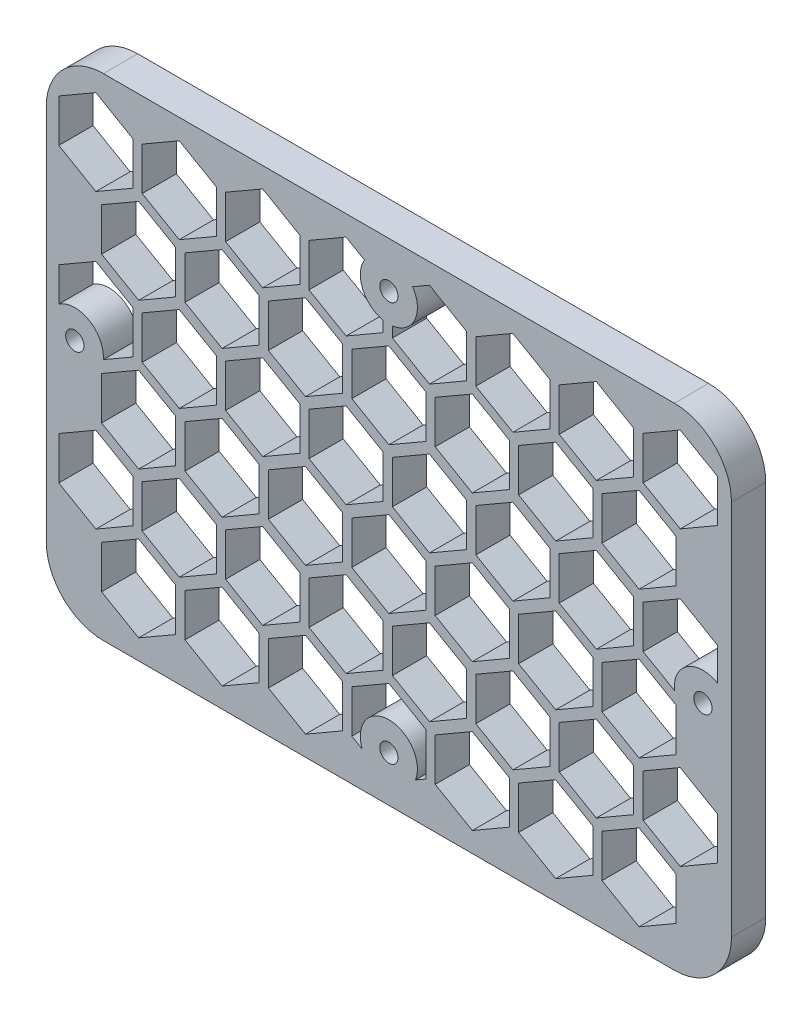
from build123d import *

# Parameters (mm, degrees)
PLAQUE_OUTLINE_R   = 1.6
PLAQUE_DEPTH       = 6
CUT_EXTRUDE2_DEPTH = 10


# Read off the part's stored shape, not the designer's step: plaque
with BuildPart() as part:
    # plaque outline → plaque (new body)
    with BuildSketch(Plane.XY):
        with BuildLine():
            Line((50, 43), (-50, 43))
            ThreePointArc((-50, 43), (-57.071067812, 40.071067812), (-60, 33))
            Line((-60, 33), (-60, -33))
            ThreePointArc((-60, -33), (-57.071067812, -40.071067812), (-50, -43))
            Line((-50, -43), (50, -43))
            ThreePointArc((50, -43), (57.071067812, -40.071067812), (60, -33))
            Line((60, -33), (60, 33))
            ThreePointArc((60, 33), (57.071067812, 40.071067812), (50, 43))
        make_face()
        with Locations((0, -35)):
            Circle(PLAQUE_OUTLINE_R, mode=Mode.SUBTRACT)
        with Locations((-55, 0)):
            Circle(PLAQUE_OUTLINE_R, mode=Mode.SUBTRACT)
        with Locations((55, 0)):
            Circle(PLAQUE_OUTLINE_R, mode=Mode.SUBTRACT)
        with Locations((0, 35)):
            Circle(PLAQUE_OUTLINE_R, mode=Mode.SUBTRACT)
    extrude(amount=PLAQUE_DEPTH)

    # Sketch2 → Cut-Extrude2 (cut)
    with BuildSketch(Plane(origin=(0, 0, 0), x_dir=(-1, 0, 0), z_dir=(0, 0, -1))):
        Polygon((-37.324809472, -35.75), (-37.324809472, -28.25), (-43.82, -24.5), (-50.315190528, -28.25), (-50.315190528, -35.75), (-43.82, -39.5), align=None)
        Polygon((-29.829618943, -23), (-29.829618943, -15.5), (-36.324809472, -11.75), (-42.82, -15.5), (-42.82, -23), (-36.324809472, -26.75), align=None)
        Polygon((-22.718142805, -35.75), (-22.718142805, -28.25), (-29.213333333, -24.5), (-35.708523862, -28.25), (-35.708523862, -35.75), (-29.213333333, -39.5), align=None)
        Polygon((-15.222952277, -23), (-15.222952277, -15.5), (-21.718142805, -11.75), (-28.213333333, -15.5), (-28.213333333, -23), (-21.718142805, -26.75), align=None)
        Polygon((-8.111476138, -35.75), (-8.111476138, -28.25), (-14.606666667, -24.5), (-21.101857195, -28.25), (-21.101857195, -35.75), (-14.606666667, -39.5), align=None)
        Polygon((-0.61628561, -23), (-0.61628561, -15.5), (-7.111476138, -11.75), (-13.606666667, -15.5), (-13.606666667, -23), (-7.111476138, -26.75), align=None)
        with BuildLine():
            Line((6.495190528, -35.75), (6.495190528, -28.25))
            Line((6.495190528, -28.25), (0, -24.5))
            Line((0, -24.5), (-6.495190528, -28.25))
            Line((-6.495190528, -28.25), (-6.495190528, -35.75))
            Line((-6.495190528, -35.75), (-4.66137396, -36.808754489))
            ThreePointArc((-4.66137396, -36.808754489), (0, -30), (4.66137396, -36.808754489))
            Line((4.66137396, -36.808754489), (6.495190528, -35.75))
        make_face()
        Polygon((13.990381057, -23), (13.990381057, -15.5), (7.495190528, -11.75), (1, -15.5), (1, -23), (7.495190528, -26.75), align=None)
        Polygon((21.101857195, -35.75), (21.101857195, -28.25), (14.606666667, -24.5), (8.111476138, -28.25), (8.111476138, -35.75), (14.606666667, -39.5), align=None)
        Polygon((28.597047723, -23), (28.597047723, -15.5), (22.101857195, -11.75), (15.606666667, -15.5), (15.606666667, -23), (22.101857195, -26.75), align=None)
        Polygon((35.708523862, -35.75), (35.708523862, -28.25), (29.213333333, -24.5), (22.718142805, -28.25), (22.718142805, -35.75), (29.213333333, -39.5), align=None)
        Polygon((43.20371439, -23), (43.20371439, -15.5), (36.708523862, -11.75), (30.213333333, -15.5), (30.213333333, -23), (36.708523862, -26.75), align=None)
        Polygon((50.315190528, -35.75), (50.315190528, -28.25), (43.82, -24.5), (37.324809472, -28.25), (37.324809472, -35.75), (43.82, -39.5), align=None)
        Polygon((57.810381057, -23), (57.810381057, -15.5), (51.315190528, -11.75), (44.82, -15.5), (44.82, -23), (51.315190528, -26.75), align=None)
        Polygon((-22.718142805, -10.15), (-22.718142805, -2.65), (-29.213333333, 1.1), (-35.708523862, -2.65), (-35.708523862, -10.15), (-29.213333333, -13.9), align=None)
        Polygon((-15.222952277, 2.6), (-15.222952277, 10.1), (-21.718142805, 13.85), (-28.213333333, 10.1), (-28.213333333, 2.6), (-21.718142805, -1.15), align=None)
        Polygon((-8.111476138, -10.15), (-8.111476138, -2.65), (-14.606666667, 1.1), (-21.101857195, -2.65), (-21.101857195, -10.15), (-14.606666667, -13.9), align=None)
        Polygon((-0.61628561, 2.6), (-0.61628561, 10.1), (-7.111476138, 13.85), (-13.606666667, 10.1), (-13.606666667, 2.6), (-7.111476138, -1.15), align=None)
        Polygon((6.495190528, -10.15), (6.495190528, -2.65), (0, 1.1), (-6.495190528, -2.65), (-6.495190528, -10.15), (0, -13.9), align=None)
        Polygon((13.990381057, 2.6), (13.990381057, 10.1), (7.495190528, 13.85), (1, 10.1), (1, 2.6), (7.495190528, -1.15), align=None)
        Polygon((21.101857195, -10.15), (21.101857195, -2.65), (14.606666667, 1.1), (8.111476138, -2.65), (8.111476138, -10.15), (14.606666667, -13.9), align=None)
        Polygon((28.597047723, 2.6), (28.597047723, 10.1), (22.101857195, 13.85), (15.606666667, 10.1), (15.606666667, 2.6), (22.101857195, -1.15), align=None)
        Polygon((35.708523862, -10.15), (35.708523862, -2.65), (29.213333333, 1.1), (22.718142805, -2.65), (22.718142805, -10.15), (29.213333333, -13.9), align=None)
        Polygon((43.20371439, 2.6), (43.20371439, 10.1), (36.708523862, 13.85), (30.213333333, 10.1), (30.213333333, 2.6), (36.708523862, -1.15), align=None)
        Polygon((50.315190528, -10.15), (50.315190528, -2.65), (43.82, 1.1), (37.324809472, -2.65), (37.324809472, -10.15), (43.82, -13.9), align=None)
        with BuildLine():
            Line((57.810381057, 4.135427223), (57.810381057, 10.1))
            Line((57.810381057, 10.1), (51.315190528, 13.85))
            Line((51.315190528, 13.85), (44.82, 10.1))
            Line((44.82, 10.1), (44.82, 2.6))
            Line((44.82, 2.6), (50.016019525, -0.399923271))
            ThreePointArc((50.016019525, -0.399923271), (52.485346021, 4.321633414), (57.810381057, 4.135427223))
        make_face()
        Polygon((-22.718142805, 15.45), (-22.718142805, 22.95), (-29.213333333, 26.7), (-35.708523862, 22.95), (-35.708523862, 15.45), (-29.213333333, 11.7), align=None)
        Polygon((-15.222952277, 28.2), (-15.222952277, 35.7), (-21.718142805, 39.45), (-28.213333333, 35.7), (-28.213333333, 28.2), (-21.718142805, 24.45), align=None)
        Polygon((-8.111476138, 15.45), (-8.111476138, 22.95), (-14.606666667, 26.7), (-21.101857195, 22.95), (-21.101857195, 15.45), (-14.606666667, 11.7), align=None)
        with BuildLine():
            ThreePointArc((-0.61628561, 30.038126156), (-4.540676264, 32.906615404), (-4.173388159, 37.753694114))
            Line((-4.173388159, 37.753694114), (-7.111476138, 39.45))
            Line((-7.111476138, 39.45), (-13.606666667, 35.7))
            Line((-13.606666667, 35.7), (-13.606666667, 28.2))
            Line((-13.606666667, 28.2), (-7.111476138, 24.45))
            Line((-7.111476138, 24.45), (-0.61628561, 28.2))
            Line((-0.61628561, 28.2), (-0.61628561, 30.038126156))
        make_face()
        with BuildLine():
            Line((7.495190528, 39.45), (4.276040949, 37.591423124))
            ThreePointArc((4.276040949, 37.591423124), (4.581013516, 32.996424405), (1, 30.101020514))
            Line((1, 30.101020514), (1, 28.2))
            Line((1, 28.2), (7.495190528, 24.45))
            Line((7.495190528, 24.45), (13.990381057, 28.2))
            Line((13.990381057, 28.2), (13.990381057, 35.7))
            Line((13.990381057, 35.7), (7.495190528, 39.45))
        make_face()
        Polygon((6.495190528, 15.45), (6.495190528, 22.95), (0, 26.7), (-6.495190528, 22.95), (-6.495190528, 15.45), (0, 11.7), align=None)
        Polygon((21.101857195, 15.45), (21.101857195, 22.95), (14.606666667, 26.7), (8.111476138, 22.95), (8.111476138, 15.45), (14.606666667, 11.7), align=None)
        Polygon((28.597047723, 28.2), (28.597047723, 35.7), (22.101857195, 39.45), (15.606666667, 35.7), (15.606666667, 28.2), (22.101857195, 24.45), align=None)
        Polygon((35.708523862, 15.45), (35.708523862, 22.95), (29.213333333, 26.7), (22.718142805, 22.95), (22.718142805, 15.45), (29.213333333, 11.7), align=None)
        Polygon((43.20371439, 28.2), (43.20371439, 35.7), (36.708523862, 39.45), (30.213333333, 35.7), (30.213333333, 28.2), (36.708523862, 24.45), align=None)
        Polygon((50.315190528, 15.45), (50.315190528, 22.95), (43.82, 26.7), (37.324809472, 22.95), (37.324809472, 15.45), (43.82, 11.7), align=None)
        Polygon((57.810381057, 28.2), (57.810381057, 35.7), (51.315190528, 39.45), (44.82, 35.7), (44.82, 28.2), (51.315190528, 24.45), align=None)
        Polygon((-37.324809472, -10.15), (-37.324809472, -2.65), (-43.82, 1.1), (-50.315190528, -2.65), (-50.315190528, -10.15), (-43.82, -13.9), align=None)
        Polygon((-29.829618943, 2.6), (-29.829618943, 10.1), (-36.324809472, 13.85), (-42.82, 10.1), (-42.82, 2.6), (-36.324809472, -1.15), align=None)
        Polygon((-37.324809472, 15.45), (-37.324809472, 22.95), (-43.82, 26.7), (-50.315190528, 22.95), (-50.315190528, 15.45), (-43.82, 11.7), align=None)
        Polygon((-29.829618943, 28.2), (-29.829618943, 35.7), (-36.324809472, 39.45), (-42.82, 35.7), (-42.82, 28.2), (-36.324809472, 24.45), align=None)
        Polygon((-51.024809472, -11.75), (-57.52, -15.5), (-57.52, -23), (-51.024809472, -26.75), (-44.529618943, -23), (-44.529618943, -15.5), align=None)
        with BuildLine():
            Line((-51.024809472, 13.85), (-57.52, 10.1))
            Line((-57.52, 10.1), (-57.52, 4.318518264))
            ThreePointArc((-57.52, 4.318518264), (-52.263305835, 4.184555538), (-50.033480753, -0.577656097))
            Line((-50.033480753, -0.577656097), (-44.529618943, 2.6))
            Line((-44.529618943, 2.6), (-44.529618943, 10.1))
            Line((-44.529618943, 10.1), (-51.024809472, 13.85))
        make_face()
        Polygon((-51.024809472, 39.45), (-57.52, 35.7), (-57.52, 28.2), (-51.024809472, 24.45), (-44.529618943, 28.2), (-44.529618943, 35.7), align=None)
    extrude(amount=-CUT_EXTRUDE2_DEPTH, mode=Mode.SUBTRACT)


solid = part.part
